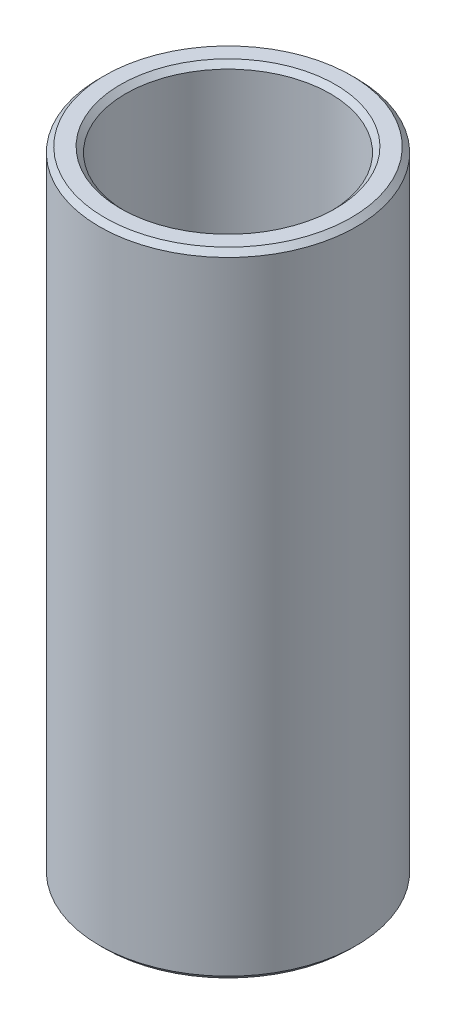
from build123d import *

# Parameters (mm, degrees)
SKETCH1_R           = 22.5
BOSS_EXTRUDE1_DEPTH = 110.848872892
SKETCH2_R           = 17.903103606
CUT_EXTRUDE1_DEPTH  = 116.325507246
CHAMFER1_SIZE       = 0.916934645


with BuildPart() as part:
    # Sketch1 → Boss-Extrude1 (new body)
    with BuildSketch(Plane(origin=(0, 0, 0), x_dir=(1, 0, 0), z_dir=(0, 1, 0))):
        Circle(SKETCH1_R)
    extrude(amount=BOSS_EXTRUDE1_DEPTH)

    # Sketch2 → Cut-Extrude1 (cut, through all)
    with BuildSketch(Plane(origin=(0, 0, 0), x_dir=(1, 0, 0), z_dir=(0, 1, 0))):
        Circle(SKETCH2_R)
    extrude(amount=CUT_EXTRUDE1_DEPTH, mode=Mode.SUBTRACT)

    # Chamfer1
    chamfer1_edges = [part.edges().sort_by_distance(p)[0] for p in [
        (-17.903103606, 110.848872892, 0),
        (-17.903103606, 0, 0),
        (-22.5, 0, 0),
        (-22.5, 110.848872892, 0),
    ]]
    chamfer(chamfer1_edges, length=CHAMFER1_SIZE)


solid = part.part
